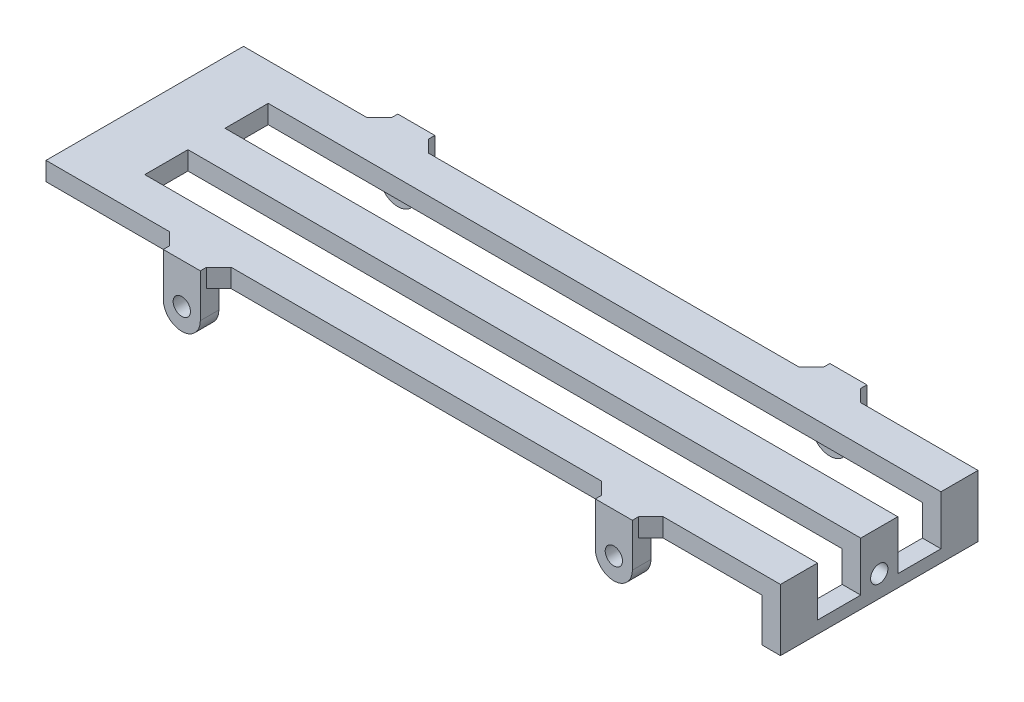
from build123d import *

# Parameters (mm, degrees)
SKETCH1_W           = 119
SKETCH1_H           = 32
SKETCH1_W_2         = 105
SKETCH1_H_2         = 7
BOSS_EXTRUDE1_DEPTH = 3
SKETCH2_W           = 6
SKETCH2_H           = 7
SKETCH2_R           = 1.4
SKETCH2_H_2         = 3
BOSS_EXTRUDE2_DEPTH = 3
CHAMFER1_SIZE       = 2
FILLET1_R           = 3
SKETCH3_W           = 3
SKETCH3_H           = 11
BOSS_EXTRUDE4_DEPTH = 32
SKETCH4_W           = 4
SKETCH4_H           = 7
CUT_EXTRUDE1_DEPTH  = 8
SKETCH5_R           = 1.4
CUT_EXTRUDE2_DEPTH  = 122.008264181
SKETCH6_W           = 32
SKETCH6_H           = 4
CUT_EXTRUDE3_DEPTH  = 10


with BuildPart() as part:
    # Sketch1 → Boss-Extrude1 (new body)
    with BuildSketch(Plane(origin=(0, 0, 0), x_dir=(1, 0, 0), z_dir=(0, 1, 0))):
        Rectangle(SKETCH1_W, SKETCH1_H)
        with Locations((3, 6.5)):
            Rectangle(SKETCH1_W_2, SKETCH1_H_2, mode=Mode.SUBTRACT)
        with Locations((3, -6.5)):
            Rectangle(SKETCH1_W_2, SKETCH1_H_2, mode=Mode.SUBTRACT)
    extrude(amount=BOSS_EXTRUDE1_DEPTH)

    # Sketch2 → Boss-Extrude2 (add)
    # profile 1 of 4: a face of its own
    with BuildSketch(Plane.XY.offset(16)):
        with Locations((35.5, -3.5)):
            Rectangle(SKETCH2_W, SKETCH2_H)
        with Locations((35.5, -3.5)):
            Circle(SKETCH2_R, mode=Mode.SUBTRACT)
    # profile 2 of 4: a face of its own
    with BuildSketch(Plane.XY.offset(16)):
        with Locations((35.5, 1.5)):
            Rectangle(SKETCH2_W, SKETCH2_H_2)
    # profile 3 of 4: a face of its own
    with BuildSketch(Plane.XY.offset(16)):
        with Locations((-34.5, -3.5)):
            Rectangle(SKETCH2_W, SKETCH2_H)
        with Locations((-34.5, -3.5)):
            Circle(SKETCH2_R, mode=Mode.SUBTRACT)
    # profile 4 of 4: a face of its own
    with BuildSketch(Plane.XY.offset(16)):
        with Locations((-34.5, 1.5)):
            Rectangle(SKETCH2_W, SKETCH2_H_2)
    boss_extrude2 = extrude(amount=BOSS_EXTRUDE2_DEPTH)

    # Mirror4: Boss-Extrude2 across plane
    add(boss_extrude2.mirror(Plane.XY))

    # Chamfer1
    chamfer1_edges = [part.edges().sort_by_distance(p)[0] for p in [
        (-31.5, 1.5, -16),
        (38.5, 1.5, 16),
        (32.5, 1.5, 16),
        (-37.5, 1.5, 16),
        (-31.5, 1.5, 16),
        (32.5, 1.5, -16),
        (38.5, 1.5, -16),
        (-37.5, 1.5, -16),
    ]]
    chamfer(chamfer1_edges, length=CHAMFER1_SIZE)

    # Fillet1
    fillet1_edges = [part.edges().sort_by_distance(p)[0] for p in [
        (32.5, -7, 17.5),
        (38.5, -7, 17.5),
        (-37.5, -7, 17.5),
        (-31.5, -7, 17.5),
        (38.5, -7, -17.5),
        (32.5, -7, -17.5),
        (-31.5, -7, -17.5),
        (-37.5, -7, -17.5),
    ]]
    fillet(fillet1_edges, radius=FILLET1_R - 0.0001)  # a hair under: the kernel refuses the full size

    # Sketch3 → Boss-Extrude4 (add)
    with BuildSketch(Plane(origin=(0, 0, -16), x_dir=(-1, 0, 0), z_dir=(0, 0, -1))):
        with Locations((-58, -5.5)):
            Rectangle(SKETCH3_W, SKETCH3_H)
    extrude(amount=-BOSS_EXTRUDE4_DEPTH)

    # Sketch4 → Cut-Extrude1 (cut)
    with BuildSketch(Plane(origin=(0, 3, 0), x_dir=(1, 0, 0), z_dir=(0, 1, 0))):
        with Locations((57.5, 6.5)):
            Rectangle(SKETCH4_W, SKETCH4_H)
        with Locations((57.5, -6.5)):
            Rectangle(SKETCH4_W, SKETCH4_H)
    extrude(amount=-CUT_EXTRUDE1_DEPTH, mode=Mode.SUBTRACT)

    # Sketch5 → Cut-Extrude2 (cut, through all)
    with BuildSketch(Plane(origin=(59.5, 0, 0), x_dir=(0, 0, -1), z_dir=(1, 0, 0))):
        with Locations((0, -3.5)):
            Circle(SKETCH5_R)
    extrude(amount=-CUT_EXTRUDE2_DEPTH, mode=Mode.SUBTRACT)

    # Sketch6 → Cut-Extrude3 (cut)
    with BuildSketch(Plane(origin=(59.5, 0, 0), x_dir=(0, 0, -1), z_dir=(1, 0, 0))):
        with Locations((0, -9)):
            Rectangle(SKETCH6_W, SKETCH6_H)
    extrude(amount=-CUT_EXTRUDE3_DEPTH, mode=Mode.SUBTRACT)


solid = part.part
